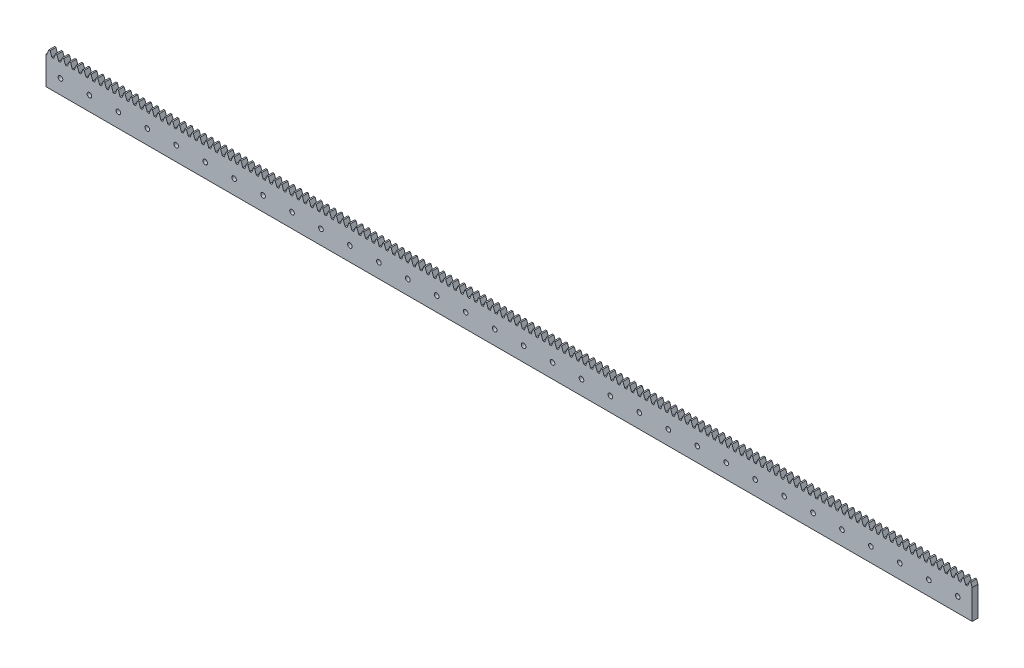
from build123d import *

# Parameters (mm, degrees)
BLANKSKE_W          = 640
BLANKSKE_H          = 23
BLANK_DEPTH         = 4
TOOTHCUTSIM_DEPTH   = 641.425639712
TEETHCUTS_COUNT     = 137
TEETHCUTS_PITCH     = 4.712388975
SKETCH_1_R          = 1.6
CUT_EXTRUDE_1_DEPTH = 641.425639712


with BuildPart() as part:
    # BlankSke → Blank (new body)
    with BuildSketch(Plane.XY):
        with Locations((320, 11.5)):
            Rectangle(BLANKSKE_W, BLANKSKE_H)
    extrude(amount=-BLANK_DEPTH)

    # TooCutSkeSim → ToothCutSim (cut, through all)
    with BuildSketch(Plane.XY):
        Polygon((0.654653055, 19.625), (-0.654653055, 19.625), (-1.892297439, 23.0254), (1.892297439, 23.0254), align=None)
    toothcutsim = extrude(amount=-TOOTHCUTSIM_DEPTH, mode=Mode.SUBTRACT)

    # TeethCuts: ToothCutSim ×137
    with Locations(*[(i * TEETHCUTS_PITCH, 0, 0) for i in range(1, TEETHCUTS_COUNT)]):
        add(toothcutsim, mode=Mode.SUBTRACT)

    # 草图1 → 切除-拉伸1 (cut, through all)
    with BuildSketch(Plane.XY):
        with Locations((10, 10)):
            Circle(SKETCH_1_R)
        with Locations((30, 10)):
            Circle(SKETCH_1_R)
        with Locations((50, 10)):
            Circle(SKETCH_1_R)
        with Locations((70, 10)):
            Circle(SKETCH_1_R)
        with Locations((90, 10)):
            Circle(SKETCH_1_R)
        with Locations((110, 10)):
            Circle(SKETCH_1_R)
        with Locations((130, 10)):
            Circle(SKETCH_1_R)
        with Locations((150, 10)):
            Circle(SKETCH_1_R)
        with Locations((170, 10)):
            Circle(SKETCH_1_R)
        with Locations((190, 10)):
            Circle(SKETCH_1_R)
        with Locations((210, 10)):
            Circle(SKETCH_1_R)
        with Locations((230, 10)):
            Circle(SKETCH_1_R)
        with Locations((250, 10)):
            Circle(SKETCH_1_R)
        with Locations((270, 10)):
            Circle(SKETCH_1_R)
        with Locations((290, 10)):
            Circle(SKETCH_1_R)
        with Locations((310, 10)):
            Circle(SKETCH_1_R)
        with Locations((330, 10)):
            Circle(SKETCH_1_R)
        with Locations((350, 10)):
            Circle(SKETCH_1_R)
        with Locations((370, 10)):
            Circle(SKETCH_1_R)
        with Locations((390, 10)):
            Circle(SKETCH_1_R)
        with Locations((410, 10)):
            Circle(SKETCH_1_R)
        with Locations((430, 10)):
            Circle(SKETCH_1_R)
        with Locations((450, 10)):
            Circle(SKETCH_1_R)
        with Locations((470, 10)):
            Circle(SKETCH_1_R)
        with Locations((490, 10)):
            Circle(SKETCH_1_R)
        with Locations((510, 10)):
            Circle(SKETCH_1_R)
        with Locations((530, 10)):
            Circle(SKETCH_1_R)
        with Locations((550, 10)):
            Circle(SKETCH_1_R)
        with Locations((570, 10)):
            Circle(SKETCH_1_R)
        with Locations((590, 10)):
            Circle(SKETCH_1_R)
        with Locations((610, 10)):
            Circle(SKETCH_1_R)
        with Locations((630, 10)):
            Circle(SKETCH_1_R)
    extrude(amount=-CUT_EXTRUDE_1_DEPTH, mode=Mode.SUBTRACT)


solid = part.part
